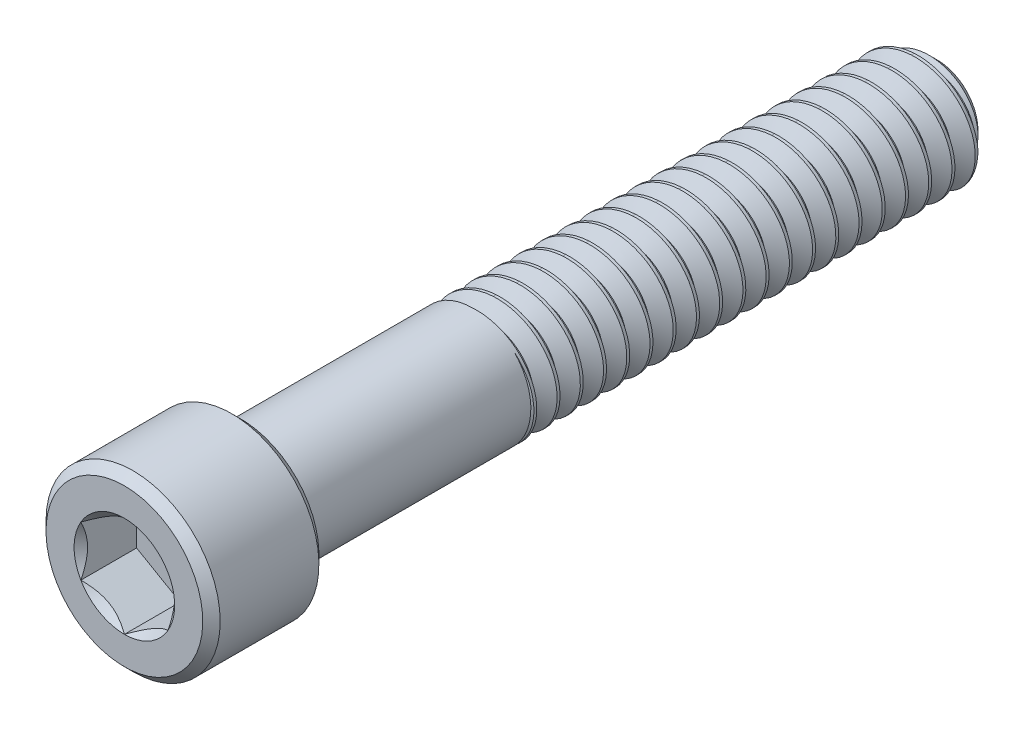
from build123d import *
from build123d.topology import SkipClean

# Parameters (mm, degrees)
CUT_EXTRUDE1_DEPTH  = 3.048
CHAMFER1_SIZE       = 0.47625
CUT_SWEEP1_PITCH    = 1.27
CUT_SWEEP1_TO       = 38.1
SKETCH9_R           = 3.175
BOSS_EXTRUDE2_DEPTH = 12.7


with BuildPart() as part:
    # Sketch3 → Revolve1 (revolve)
    with BuildSketch(Plane(origin=(0, 0, 0), x_dir=(0, 0, -1), z_dir=(1, 0, 0)), mode=Mode.PRIVATE) as revolve1_sk:
        Polygon((-22.225, 4.7625), (-22.225, 2.38125), (-19.177, 2.38125), (-19.177, 0), (22.225, 0), (22.225, 2.2225), (21.2725, 3.175), (-15.875, 3.175), (-15.875, 4.7625), align=None)
    revolve(revolve1_sk.sketch.rotate(Axis((0, 0, 22.225), (0, 0, -1)), 180), axis=Axis((0, 0, 22.225), (0, 0, -1)))

    # Sketch4 → Cut-Extrude1 (cut)
    with BuildSketch(Plane.XY.offset(22.225)):
        Polygon((0, 2.749630657), (-2.38125, 1.374815329), (-2.38125, -1.374815329), (0, -2.749630657), (2.38125, -1.374815329), (2.38125, 1.374815329), align=None)
    extrude(amount=-CUT_EXTRUDE1_DEPTH, mode=Mode.SUBTRACT)

    # Cut-Extrude2 cone 1 section (through the dimple's axis) → Cut-Extrude2 (revolve, cut)
    with BuildSketch(Plane(origin=(0, 0, 22.225), x_dir=(0, -1, 0), z_dir=(1, 0, 0))):
        Polygon((0, 0), (2.749630657, 0), (0, 2.749630657), align=None)
    revolve(axis=Axis((0, 0, 22.225), (0, 0, -1)), mode=Mode.SUBTRACT)

    # Chamfer1
    chamfer1_edges = [part.edges().sort_by_distance(p)[0] for p in [
        (0, 4.7625, 22.225),
        (0, 4.7625, 15.875),
    ]]
    chamfer(chamfer1_edges, length=CHAMFER1_SIZE)


with BuildPart() as body_2:
    # Split1: read off the stored shape, not the designer's step
    # Split1: the piece on the far side of the plane
    add(part.part)
    split(bisect_by=Plane.XY.offset(15.875), keep=Keep.BOTTOM)

    # Cut-Sweep1: arcs per turn and ends read off the stored shape
    # Cut-Sweep1: the profile of Sketch7 screwed along a right-hand helix through 31 turns, 8 arcs to a turn; built about Z, then put on its axis
    cut_sweep1_z = Axis((0, 0, 0), (0, 0, 1))
    cut_sweep1_corners = [(2.350110803, 0, -0.47625), (2.350110803, 0, -0.635), (3.243740766, 0, -1.1509375), (3.243740766, 0, 0.0396875)]
    with BuildLine(mode=Mode.PRIVATE) as cut_sweep1_profile:
        Line(cut_sweep1_corners[0], cut_sweep1_corners[1])
        Line(cut_sweep1_corners[1], cut_sweep1_corners[2])
        Line(cut_sweep1_corners[2], cut_sweep1_corners[3])
        Line(cut_sweep1_corners[3], cut_sweep1_corners[0])
    cut_sweep1_cap = Face(cut_sweep1_profile.wire())
    cut_sweep1_turn_angles = [0, 22.5, 45, 67.5, 90, 112.5, 135, 157.5, 180, 202.5, 225, 247.5, 270, 292.5, 315, 337.5, 360]
    cut_sweep1_turn_weights = [1, 0.9238795325112867, 1, 0.9238795325112867, 1, 0.9238795325112867, 1, 0.9238795325112867, 1, 0.9238795325112867, 1, 0.9238795325112867, 1, 0.9238795325112867, 1, 0.9238795325112867, 1]
    cut_sweep1_turn_rails = [Edge.make_bspline([Vector(p[0], p[1], 0).rotate(cut_sweep1_z, cut_sweep1_turn_angles[k]) / cut_sweep1_turn_weights[k] + Vector(0, 0, p[2] + CUT_SWEEP1_PITCH * cut_sweep1_turn_angles[k] / 360) for k in range(17)], [0, 0, 0, 1, 1, 2, 2, 3, 3, 4, 4, 5, 5, 6, 6, 7, 7, 8, 8, 8], 2, cut_sweep1_turn_weights) for p in cut_sweep1_corners]
    cut_sweep1_turn_sides = [Face.make_surface_from_curves(cut_sweep1_turn_rails[p[0]], cut_sweep1_turn_rails[p[1]]) for p in [(0, 1), (1, 2), (2, 3), (3, 0)]]
    cut_sweep1 = Plane(origin=(0, 0, -22.225), x_dir=(0, 1, 0), z_dir=(0, 0, 1)) * split(Solid(Shell([*[p.moved(Location((0, 0, CUT_SWEEP1_PITCH * i))) for i in range(31) for p in cut_sweep1_turn_sides], cut_sweep1_cap, cut_sweep1_cap.rotate(cut_sweep1_z, 11160).moved(Location((0, 0, CUT_SWEEP1_PITCH * 11160 / 360)))])), bisect_by=Plane.XY.offset(CUT_SWEEP1_TO), keep=Keep.BOTTOM, mode=Mode.PRIVATE)
    add(cut_sweep1, mode=Mode.SUBTRACT)


with BuildPart() as part_1:
    add(part.part)

    # Split1
    split(bisect_by=Plane.XY.offset(15.875), keep=Keep.TOP)

    add(body_2.part)  # Boss-Extrude1 merges body 2
    # Boss-Extrude1: read off the stored shape, not the designer's step
    # Boss-Extrude1 outline → Boss-Extrude1 (revolve)
    with BuildSketch(Plane.XZ):
        Polygon((2.35010135, 15.875), (2.35010135, 15.215435832), (3.4925, 15.875), align=None)
    revolve(axis=Axis((0, 0, 0), (0, 0, 1)))

    # Sketch9 → Boss-Extrude2 (add)
    with SkipClean():  # the faces are left unmerged after this step: merging them gives an invalid solid
        with BuildSketch(Plane(origin=(0, 0, 15.875), x_dir=(-1, 0, 0), z_dir=(0, 0, -1))):
            with Locations(Location((0, 0, 0), (0, 0, 90))):
                Circle(SKETCH9_R)
        extrude(amount=BOSS_EXTRUDE2_DEPTH)


solid = part_1.part
